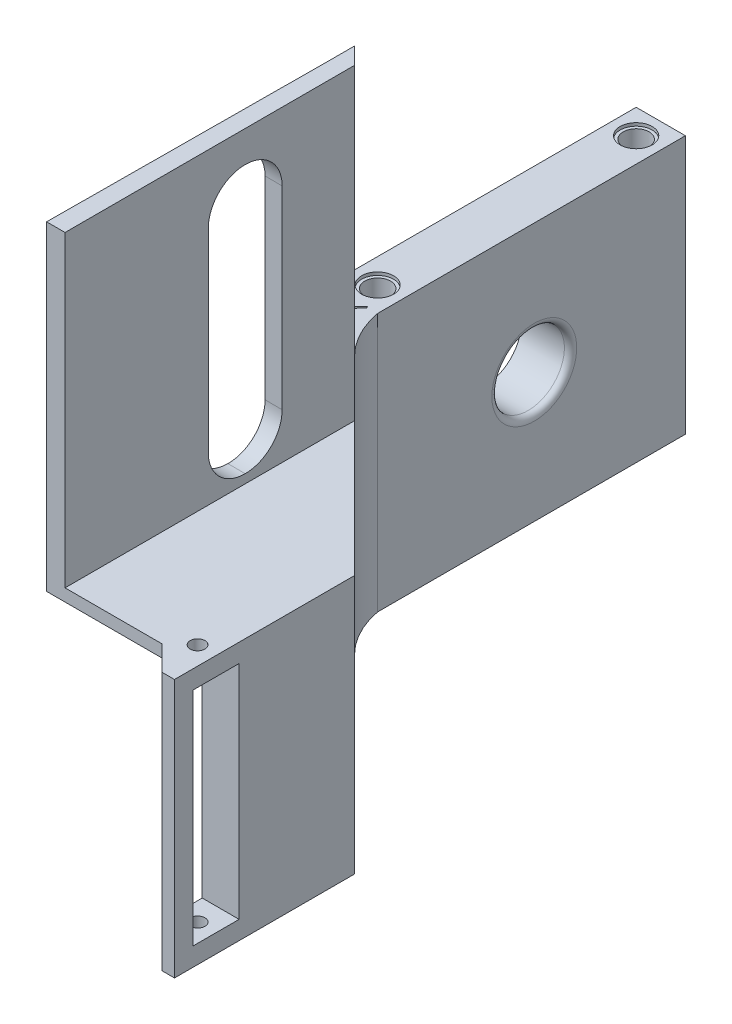
from build123d import *

# Parameters (mm, degrees)
SKETCH1_W           = 25
SKETCH1_H           = 50
SKETCH1_R           = 3.4
BOSS_EXTRUDE1_DEPTH = 3
SKETCH2_W           = 50
SKETCH2_H           = 3
BOSS_EXTRUDE2_DEPTH = 8
SKETCH3_W           = 8
SKETCH3_H           = 50
BOSS_EXTRUDE3_DEPTH = 42
SKETCH4_R           = 2.65
CUT_EXTRUDE1_DEPTH  = 0.5
SKETCH5_R           = 5.888972746
CUT_EXTRUDE2_DEPTH  = 9
FILLET2_R           = 1
SKETCH6_R           = 12.6
BOSS_EXTRUDE4_DEPTH = 2
FILLET4_R           = 1
SKETCH8_R           = 1.589780168
SKETCH8_R_2         = 1.777428262
CUT_EXTRUDE3_DEPTH  = 10
SKETCH9_W           = 49.021678163
SKETCH9_H           = 20.976854622
CUT_EXTRUDE4_DEPTH  = 68.79439129
SKETCH11_R          = 2.1
CUT_EXTRUDE5_DEPTH  = 59.480168703
SKETCH14_R          = 2.6
CUT_EXTRUDE6_DEPTH  = 0.5
BOSS_EXTRUDE5_DEPTH = 42
FILLET5_R           = 15
BOSS_EXTRUDE6_DEPTH = 42
SKETCH18_W          = 7.5
SKETCH18_H          = 36
CUT_EXTRUDE7_DEPTH  = 8
SKETCH19_R          = 1.2
CUT_EXTRUDE8_DEPTH  = 96.073366415
FILL_START          = -25
FILL_PATTERN1_DEPTH = 5.486929266
CHAMFER1_SIZE       = 4
CUT_EXTRUDE9_DEPTH  = 96.073366415
BOSS_EXTRUDE7_DEPTH = 2
BOSS_EXTRUDE8_DEPTH = 50
SKETCH23_W          = 11.999777708
SKETCH23_H          = 43.48627111
CUT_EXTRUDE10_DEPTH = 99.748614241
FILLET6_R           = 6
FILLET7_R           = 6
FILLET8_R           = 6
FILLET9_R           = 6


with BuildPart() as part:
    # Sketch1 → Boss-Extrude1 (new body)
    with BuildSketch(Plane(origin=(0, 0, 0), x_dir=(1, 0, 0), z_dir=(0, 1, 0))):
        with Locations((2.276951673, 11.384758364)):
            Rectangle(SKETCH1_W, SKETCH1_H)
        with Locations(Location((1.276951673, 11.384758364, 0), (0, 0, 270))):
            Circle(SKETCH1_R, mode=Mode.SUBTRACT)
    extrude(amount=BOSS_EXTRUDE1_DEPTH)

    # Sketch2 → Boss-Extrude2 (add)
    with BuildSketch(Plane.ZY.offset(10.223048327)):
        with Locations((-11.384758364, 1.5)):
            Rectangle(SKETCH2_W, SKETCH2_H)
    extrude(amount=BOSS_EXTRUDE2_DEPTH)

    # Sketch3 → Boss-Extrude3 (add)
    with BuildSketch(Plane.XZ):
        with Locations((-14.223048327, -11.384758364)):
            Rectangle(SKETCH3_W, SKETCH3_H)
    extrude(amount=BOSS_EXTRUDE3_DEPTH)

    # Sketch4 → Cut-Extrude1 (cut)
    with BuildSketch(Plane(origin=(0, 3, 0), x_dir=(1, 0, 0), z_dir=(0, 1, 0))):
        with Locations(Location((-14.223048327, 32.384758364, 0), (0, 0, 270))):
            Circle(SKETCH4_R)
        with Locations(Location((-14.223048327, -9.615241636, 0), (0, 0, 270))):
            Circle(SKETCH4_R)
    cut_extrude1 = extrude(amount=-CUT_EXTRUDE1_DEPTH, mode=Mode.SUBTRACT)

    # Mirror1: Cut-Extrude1 across plane
    add(cut_extrude1.mirror(Plane.ZX.offset(-19.5)), mode=Mode.SUBTRACT)

    # Sketch5 → Cut-Extrude2 (cut)
    with BuildSketch(Plane.ZY.offset(18.223048327)):
        with Locations((-11.836279124, -21)):
            Circle(SKETCH5_R)
    extrude(amount=-CUT_EXTRUDE2_DEPTH, mode=Mode.SUBTRACT)

    # Fillet2
    fillet2_edges = [part.edges().sort_by_distance(p)[0] for p in [
        (-10.223048327, -21, -17.72525187),
    ]]
    fillet(fillet2_edges, radius=FILLET2_R)

    # Mirror2: Cut-Extrude1 across plane
    add(cut_extrude1.mirror(Plane.ZY.offset(1.723048327)), mode=Mode.SUBTRACT)

    # Sketch6 → Boss-Extrude4 (add)
    with BuildSketch(Plane(origin=(0, 3, 0), x_dir=(1, 0, 0), z_dir=(0, 1, 0))):
        with BuildLine():
            Line((14.776951673, 5.825082115), (14.776951673, 16.944434614))
            ThreePointArc((14.776951673, 16.944434614), (-13.323048327, 11.384758364), (14.776951673, 5.825082115))
        make_face()
        with Locations(Location((1.276951673, 11.384758364, 0), (0, 0, 270))):
            Circle(SKETCH6_R, mode=Mode.SUBTRACT)
    extrude(amount=BOSS_EXTRUDE4_DEPTH)

    # Fillet4
    # the kernel refuses this fillet: 1 mm, written as the material it takes off along each edge
    with BuildSketch(Plane(origin=(14.776951673, 5, -3.325082115), x_dir=(0, -1, 0), z_dir=(0, 0, -1))) as fillet4_piece_1:
        with BuildLine():
            CenterArc((FILLET4_R, FILLET4_R), FILLET4_R, 180, 90)
            Line((0, FILLET4_R), (0, 0))
            Line((0, 0), (FILLET4_R, 0))
        make_face()
    extrude(amount=16.119352499, mode=Mode.SUBTRACT)

    # Sketch8 → Cut-Extrude3 (cut)
    with BuildSketch(Plane(origin=(0, 3, 0), x_dir=(1, 0, 0), z_dir=(0, 1, 0))):
        with Locations(Location((1.276951673, 19.884758364, 0), (0, 0, 270))):
            Circle(SKETCH8_R)
        with Locations(Location((1.276951673, 2.884758364, 0), (0, 0, 270))):
            Circle(SKETCH8_R_2)
    extrude(amount=-CUT_EXTRUDE3_DEPTH, mode=Mode.SUBTRACT)

    # Sketch9 → Cut-Extrude4 (cut, through all)
    with BuildSketch(Plane.XY.offset(13.615241636)):
        with Locations((-9.733887409, 10.488427311)):
            Rectangle(SKETCH9_W, SKETCH9_H)
    extrude(amount=-CUT_EXTRUDE4_DEPTH, mode=Mode.SUBTRACT)

    # Sketch11 → Cut-Extrude5 (cut, through all)
    with BuildSketch(Plane(origin=(0, 0, 0), x_dir=(1, 0, 0), z_dir=(0, 1, 0))):
        with Locations(Location((-14.223048327, 32.384758364, 0), (0, 0, 270))):
            Circle(SKETCH11_R)
    cut_extrude5 = extrude(amount=-CUT_EXTRUDE5_DEPTH, mode=Mode.SUBTRACT)

    # Mirror3: Cut-Extrude5 across plane
    add(cut_extrude5.mirror(Plane.XY.offset(-11.384758364)), mode=Mode.SUBTRACT)

    # Sketch14 → Cut-Extrude6 (cut)
    with BuildSketch(Plane(origin=(0, 0, 0), x_dir=(1, 0, 0), z_dir=(0, 1, 0))):
        with Locations(Location((-14.223048327, -9.615241636, 0), (0, 0, 270))):
            Circle(SKETCH14_R)
    cut_extrude6 = extrude(amount=-CUT_EXTRUDE6_DEPTH, mode=Mode.SUBTRACT)

    # Mirror4: Cut-Extrude6 across plane
    add(cut_extrude6.mirror(Plane.XY.offset(-11.384758364)), mode=Mode.SUBTRACT)

    # Sketch16 → Boss-Extrude5 (add)
    with BuildSketch(Plane(origin=(0, 0, 0), x_dir=(1, 0, 0), z_dir=(0, 1, 0))):
        Polygon((-18.223048327, -13.615241636), (24.776951673, -56.615241636), (24.776951673, -52.372600949), (-13.98040764, -13.615241636), align=None)
    extrude(amount=-BOSS_EXTRUDE5_DEPTH)

    # Fillet5
    # the kernel refuses this fillet: 15 mm, written as the material it adds along each edge
    with BuildSketch(Plane(origin=(-13.98040764, 0, 13.615241636), x_dir=(1, 0, 0), z_dir=(0, -1, 0))) as fillet5_piece_1:
        with BuildLine():
            CenterArc((18.512169169, -2.701034267), FILLET5_R, 135, 34.626223963)
            Line((7.905567451, 7.905567451), (0, 0))
            Line((0, 0), (3.757359313, 0))
        make_face()
    extrude(amount=42)

    # Sketch17 → Boss-Extrude6 (add)
    with BuildSketch(Plane(origin=(0, 0, 0), x_dir=(1, 0, 0), z_dir=(0, 1, 0))):
        Polygon((24.776951673, -56.615241636), (24.776951673, -81.615241636), (18.776951673, -81.615241636), (18.776951673, -50.615241636), align=None)
    extrude(amount=-BOSS_EXTRUDE6_DEPTH)

    # Sketch18 → Cut-Extrude7 (cut)
    with BuildSketch(Plane(origin=(24.776951673, 0, 0), x_dir=(0, 0, -1), z_dir=(1, 0, 0))):
        with Locations((-74.865241636, -21)):
            Rectangle(SKETCH18_W, SKETCH18_H)
    extrude(amount=-CUT_EXTRUDE7_DEPTH, mode=Mode.SUBTRACT)

    # Sketch19 → Cut-Extrude8 (cut, through all)
    with BuildSketch(Plane(origin=(0, 0, 0), x_dir=(1, 0, 0), z_dir=(0, 1, 0))):
        with Locations(Location((21.776951673, -74.865241636, 0), (0, 0, 270))):
            Circle(SKETCH19_R)
    extrude(amount=-CUT_EXTRUDE8_DEPTH, mode=Mode.SUBTRACT)

    # Fill Pattern1: read off the stored shape, not the designer's step
    # Fill Pattern1 outline → Fill Pattern1 (cut)
    with BuildSketch(Plane(origin=(0, 0, 0), x_dir=(0.7071067811865468, 0, 0.7071067811865482), z_dir=(0.7071067811865481, 0, -0.707106781186547)).offset(FILL_START)):
        Polygon((45.971737286, 5.859685187), (47.221737286, 3.694621678), (49.721737286, 3.694621678), (50.971737286, 5.859685187), (49.721737286, 8.024748697), (47.221737286, 8.024748697), align=None)
        Polygon((30.237460587, 33.11225185), (31.487460587, 30.947188341), (33.987460587, 30.947188341), (35.237460587, 33.11225185), (33.987460587, 35.27731536), (31.487460587, 35.27731536), align=None)
        Polygon((40.726978386, 14.943874075), (41.976978386, 12.778810565), (44.476978386, 12.778810565), (45.726978386, 14.943874075), (44.476978386, 17.108937584), (41.976978386, 17.108937584), align=None)
        Polygon((35.482219487, 24.028062963), (36.732219487, 21.862999453), (39.232219487, 21.862999453), (40.482219487, 24.028062963), (39.232219487, 26.193126472), (36.732219487, 26.193126472), align=None)
        Polygon((15.753183888, 3.694621678), (18.253183888, 3.694621678), (19.503183888, 5.859685187), (18.253183888, 8.024748697), (15.753183888, 8.024748697), (14.503183888, 5.859685187), align=None)
        Polygon((26.242701687, 3.694621678), (28.742701687, 3.694621678), (29.992701687, 5.859685187), (28.742701687, 8.024748697), (26.242701687, 8.024748697), (24.992701687, 5.859685187), align=None)
        Polygon((36.732219487, 3.694621678), (39.232219487, 3.694621678), (40.482219487, 5.859685187), (39.232219487, 8.024748697), (36.732219487, 8.024748697), (35.482219487, 5.859685187), align=None)
        Polygon((45.971737286, 11.915811112), (47.221737286, 9.750747603), (49.721737286, 9.750747603), (50.971737286, 11.915811112), (49.721737286, 14.080874622), (47.221737286, 14.080874622), align=None)
        Polygon((40.726978386, 21), (41.976978386, 18.834936491), (44.476978386, 18.834936491), (45.726978386, 21), (44.476978386, 23.165063509), (41.976978386, 23.165063509), align=None)
        Polygon((35.482219487, 30.084188888), (36.732219487, 27.919125378), (39.232219487, 27.919125378), (40.482219487, 30.084188888), (39.232219487, 32.249252397), (36.732219487, 32.249252397), align=None)
        Polygon((15.753183888, 9.750747603), (18.253183888, 9.750747603), (19.503183888, 11.915811112), (18.253183888, 14.080874622), (15.753183888, 14.080874622), (14.503183888, 11.915811112), align=None)
        Polygon((26.242701687, 9.750747603), (28.742701687, 9.750747603), (29.992701687, 11.915811112), (28.742701687, 14.080874622), (26.242701687, 14.080874622), (24.992701687, 11.915811112), align=None)
        Polygon((36.732219487, 9.750747603), (39.232219487, 9.750747603), (40.482219487, 11.915811112), (39.232219487, 14.080874622), (36.732219487, 14.080874622), (35.482219487, 11.915811112), align=None)
        Polygon((45.971737286, 17.971937037), (47.221737286, 15.806873528), (49.721737286, 15.806873528), (50.971737286, 17.971937037), (49.721737286, 20.137000547), (47.221737286, 20.137000547), align=None)
        Polygon((40.726978386, 27.056125925), (41.976978386, 24.891062416), (44.476978386, 24.891062416), (45.726978386, 27.056125925), (44.476978386, 29.221189435), (41.976978386, 29.221189435), align=None)
        Polygon((35.482219487, 36.140314813), (36.732219487, 33.975251303), (39.232219487, 33.975251303), (40.482219487, 36.140314813), (39.232219487, 38.305378322), (36.732219487, 38.305378322), align=None)
        Polygon((15.753183888, 15.806873528), (18.253183888, 15.806873528), (19.503183888, 17.971937037), (18.253183888, 20.137000547), (15.753183888, 20.137000547), (14.503183888, 17.971937037), align=None)
        Polygon((26.242701687, 15.806873528), (28.742701687, 15.806873528), (29.992701687, 17.971937037), (28.742701687, 20.137000547), (26.242701687, 20.137000547), (24.992701687, 17.971937037), align=None)
        Polygon((36.732219487, 15.806873528), (39.232219487, 15.806873528), (40.482219487, 17.971937037), (39.232219487, 20.137000547), (36.732219487, 20.137000547), (35.482219487, 17.971937037), align=None)
        Polygon((44.476978386, 6.72268464), (45.726978386, 8.88774815), (44.476978386, 11.052811659), (41.976978386, 11.052811659), (40.726978386, 8.88774815), (41.976978386, 6.72268464), align=None)
        Polygon((45.971737286, 24.028062963), (47.221737286, 21.862999453), (49.721737286, 21.862999453), (50.971737286, 24.028062963), (49.721737286, 26.193126472), (47.221737286, 26.193126472), align=None)
        Polygon((40.726978386, 33.11225185), (41.976978386, 30.947188341), (44.476978386, 30.947188341), (45.726978386, 33.11225185), (44.476978386, 35.27731536), (41.976978386, 35.27731536), align=None)
        Polygon((15.753183888, 21.862999453), (18.253183888, 21.862999453), (19.503183888, 24.028062963), (18.253183888, 26.193126472), (15.753183888, 26.193126472), (14.503183888, 24.028062963), align=None)
        Polygon((26.242701687, 21.862999453), (28.742701687, 21.862999453), (29.992701687, 24.028062963), (28.742701687, 26.193126472), (26.242701687, 26.193126472), (24.992701687, 24.028062963), align=None)
        Polygon((45.971737286, 36.140314813), (47.221737286, 33.975251303), (49.721737286, 33.975251303), (50.971737286, 36.140314813), (49.721737286, 38.305378322), (47.221737286, 38.305378322), align=None)
        Polygon((15.753183888, 33.975251303), (18.253183888, 33.975251303), (19.503183888, 36.140314813), (18.253183888, 38.305378322), (15.753183888, 38.305378322), (14.503183888, 36.140314813), align=None)
        Polygon((26.242701687, 33.975251303), (28.742701687, 33.975251303), (29.992701687, 36.140314813), (28.742701687, 38.305378322), (26.242701687, 38.305378322), (24.992701687, 36.140314813), align=None)
        Polygon((33.987460587, 6.72268464), (35.237460587, 8.88774815), (33.987460587, 11.052811659), (31.487460587, 11.052811659), (30.237460587, 8.88774815), (31.487460587, 6.72268464), align=None)
        Polygon((45.971737286, 30.084188888), (47.221737286, 27.919125378), (49.721737286, 27.919125378), (50.971737286, 30.084188888), (49.721737286, 32.249252397), (47.221737286, 32.249252397), align=None)
        Polygon((15.753183888, 27.919125378), (18.253183888, 27.919125378), (19.503183888, 30.084188888), (18.253183888, 32.249252397), (15.753183888, 32.249252397), (14.503183888, 30.084188888), align=None)
        Polygon((26.242701687, 27.919125378), (28.742701687, 27.919125378), (29.992701687, 30.084188888), (28.742701687, 32.249252397), (26.242701687, 32.249252397), (24.992701687, 30.084188888), align=None)
        Polygon((19.747942788, 27.056125925), (20.997942788, 24.891062416), (23.497942788, 24.891062416), (24.747942788, 27.056125925), (23.497942788, 29.221189435), (20.997942788, 29.221189435), align=None)
        Polygon((19.747942788, 8.88774815), (20.997942788, 6.72268464), (23.497942788, 6.72268464), (24.747942788, 8.88774815), (23.497942788, 11.052811659), (20.997942788, 11.052811659), align=None)
        Polygon((33.987460587, 24.891062416), (35.237460587, 27.056125925), (33.987460587, 29.221189435), (31.487460587, 29.221189435), (30.237460587, 27.056125925), (31.487460587, 24.891062416), align=None)
        Polygon((19.747942788, 14.943874075), (20.997942788, 12.778810565), (23.497942788, 12.778810565), (24.747942788, 14.943874075), (23.497942788, 17.108937584), (20.997942788, 17.108937584), align=None)
        Polygon((31.487460587, 12.778810565), (33.987460587, 12.778810565), (35.237460587, 14.943874075), (33.987460587, 17.108937584), (31.487460587, 17.108937584), (30.237460587, 14.943874075), align=None)
        Polygon((19.747942788, 21), (20.997942788, 18.834936491), (23.497942788, 18.834936491), (24.747942788, 21), (23.497942788, 23.165063509), (20.997942788, 23.165063509), align=None)
        Polygon((31.487460587, 18.834936491), (33.987460587, 18.834936491), (35.237460587, 21), (33.987460587, 23.165063509), (31.487460587, 23.165063509), (30.237460587, 21), align=None)
        Polygon((20.997942788, 30.947188341), (23.497942788, 30.947188341), (24.747942788, 33.11225185), (23.497942788, 35.27731536), (20.997942788, 35.27731536), (19.747942788, 33.11225185), align=None)
    extrude(amount=FILL_PATTERN1_DEPTH, mode=Mode.SUBTRACT)

    # Chamfer1
    # the kernel refuses this chamfer: 4 mm, written as the material it takes off along each edge
    with BuildSketch(Plane(origin=(18.776951673, 10.286731952, 81.615241636), x_dir=(1, 0, 0), z_dir=(0, -1, 0))) as chamfer1_piece_1:
        Polygon((CHAMFER1_SIZE, 0), (0, -CHAMFER1_SIZE), (0, 0), align=None)
    extrude(amount=62.573463904, mode=Mode.SUBTRACT)

    # Sketch20 → Cut-Extrude9 (cut, through all)
    with BuildSketch(Plane(origin=(0, 0, 0), x_dir=(1, 0, 0), z_dir=(0, 1, 0))):
        Polygon((-12.007369699, -13.422049918), (-13.646299524, -15.19356362), (-10.796749548, -17.829847178), (-10.525107778, -17.536230508), (-13.131913788, -15.124523438), (-11.876337797, -13.743390342), align=None)
    extrude(amount=-CUT_EXTRUDE9_DEPTH, mode=Mode.SUBTRACT)

    # Sketch21 → Boss-Extrude7 (add)
    with BuildSketch(Plane(origin=(0, 0, 0), x_dir=(1, 0, 0), z_dir=(0, 1, 0))):
        Polygon((18.776951673, -77.615241636), (0, -77.615241636), (0.276951673, -32.115241636), (18.776951673, -50.615241636), align=None)
    extrude(amount=-BOSS_EXTRUDE7_DEPTH)

    # Sketch22 → Boss-Extrude8 (add)
    with BuildSketch(Plane(origin=(0, 0, 0), x_dir=(1, 0, 0), z_dir=(0, 1, 0))):
        Polygon((0, -77.615241636), (0.276951673, -32.115241636), (0.276951673, -27.872600949), (3, -30.595649276), (3, -77.615241636), align=None)
    extrude(amount=BOSS_EXTRUDE8_DEPTH)

    # Sketch23 → Cut-Extrude10 (cut, through all)
    with BuildSketch(Plane(origin=(0.472414827, 0, 0.002875518), x_dir=(-0.006086737198043906, 0, 0.9999814756435651), z_dir=(-0.9999814756435651, 0, -0.006086737198043906))):
        with Locations((48.332972082, 23.171442648)):
            Rectangle(SKETCH23_W, SKETCH23_H)
    extrude(amount=-CUT_EXTRUDE10_DEPTH, mode=Mode.SUBTRACT)

    # Fillet6
    fillet6_edges = [part.edges().sort_by_distance(p)[0] for p in [
        (1.607372237, 44.914578203, 42.343651269),
    ]]
    fillet(fillet6_edges, radius=FILLET6_R)

    # Fillet7
    # the kernel refuses this fillet: 6 mm, written as the material it adds along each edge
    with BuildSketch(Plane(origin=(0.141704981, 44.914578203, 54.334729972), x_dir=(0.006086737198043904, 0, -0.999981475643565), z_dir=(0.9999814756435651, 0, 0.006086737198043906))) as fillet7_piece_1_section:
        with BuildLine():
            CenterArc((6, -5.999999996), FILLET7_R, 90.002122735, 89.997877265)
            Line((0, -5.999999996), (-0.12, -5.999999996))
            Line((-0.12, -5.999999996), (-0.12, 0))
            Line((-0.12, 0), (0, 0.12))
            Line((0, 0.12), (5.999773262, 0.12))
            Line((5.999773262, 0.12), (5.999777708, 0))
        make_face()
    fillet7_piece_1 = extrude(amount=17.858347957, mode=Mode.PRIVATE)
    fillet7_piece_1 = split(fillet7_piece_1, bisect_by=Plane(origin=(3, 44.914578203, 54.334729972), z_dir=(-1, 0, 0)), keep=Keep.TOP, mode=Mode.PRIVATE)
    add(fillet7_piece_1)

    # Fillet8
    fillet8_edges = [part.edges().sort_by_distance(p)[0] for p in [
        (1.607372237, 1.428307093, 42.343651269),
    ]]
    fillet(fillet8_edges, radius=FILLET8_R)

    # Fillet9
    # the kernel refuses this fillet: 6 mm, written as the material it adds along each edge
    with BuildSketch(Plane(origin=(0.141704981, 1.428307093, 54.334729972), x_dir=(0.006086737198043904, 0, -0.999981475643565), z_dir=(0.9999814756435651, 0, 0.006086737198043906))) as fillet9_piece_1_section:
        with BuildLine():
            CenterArc((6, 5.999999996), FILLET9_R, 180, 89.997877265)
            Line((0, 5.999999996), (-0.12, 5.999999996))
            Line((-0.12, 5.999999996), (-0.12, 0))
            Line((-0.12, 0), (0, -0.12))
            Line((0, -0.12), (5.999773262, -0.12))
            Line((5.999773262, -0.12), (5.999777708, 0))
        make_face()
    fillet9_piece_1 = extrude(amount=17.858347957, mode=Mode.PRIVATE)
    fillet9_piece_1 = split(fillet9_piece_1, bisect_by=Plane(origin=(3, 1.428307093, 54.334729972), z_dir=(-1, 0, 0)), keep=Keep.TOP, mode=Mode.PRIVATE)
    add(fillet9_piece_1)


solid = part.part
